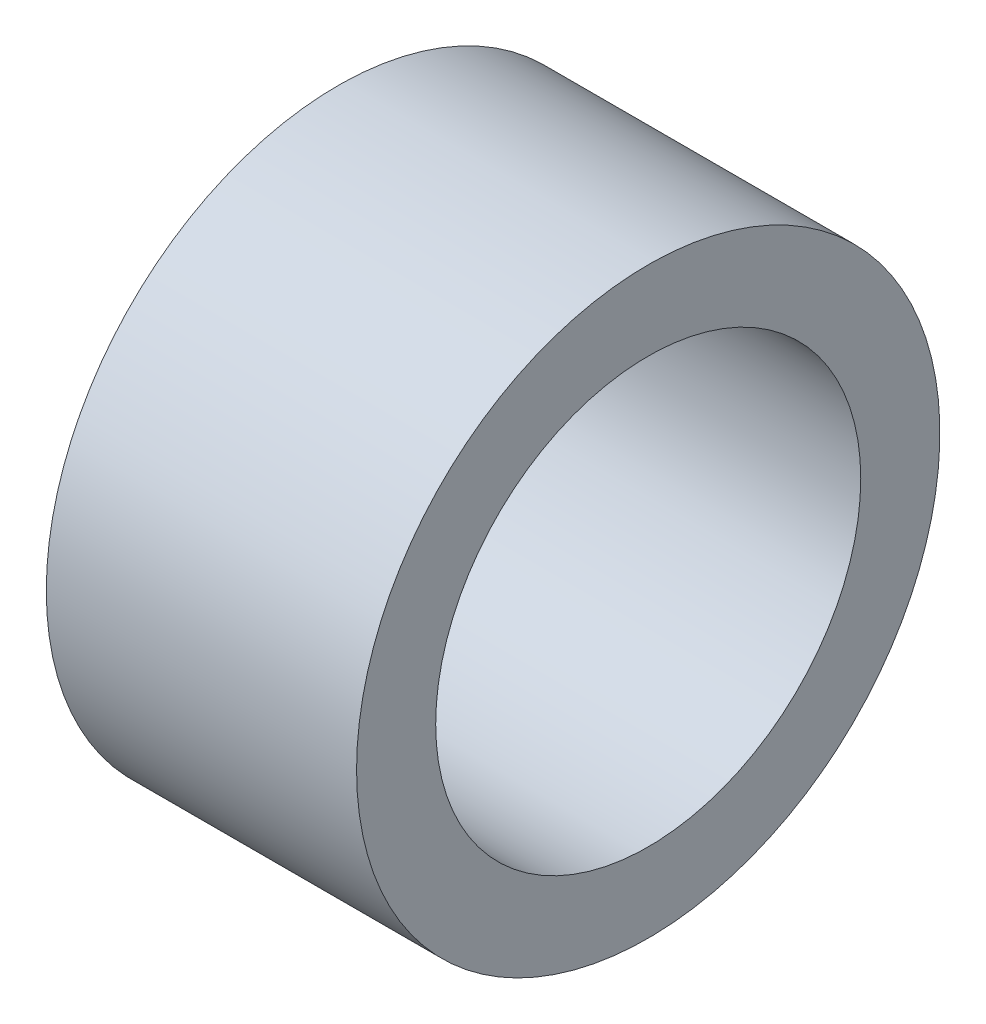
from build123d import *

# Parameters (mm, degrees)
SKETCH1_W = 6.35
SKETCH1_H = 1.61925


with BuildPart() as part:
    # Sketch1 → Revolve1 (revolve)
    with BuildSketch(Plane.XY):
        with Locations((34.925, 5.159375)):
            Rectangle(SKETCH1_W, SKETCH1_H)
    revolve(axis=Axis((0, 0, 0), (1, 0, 0)))


solid = part.part
